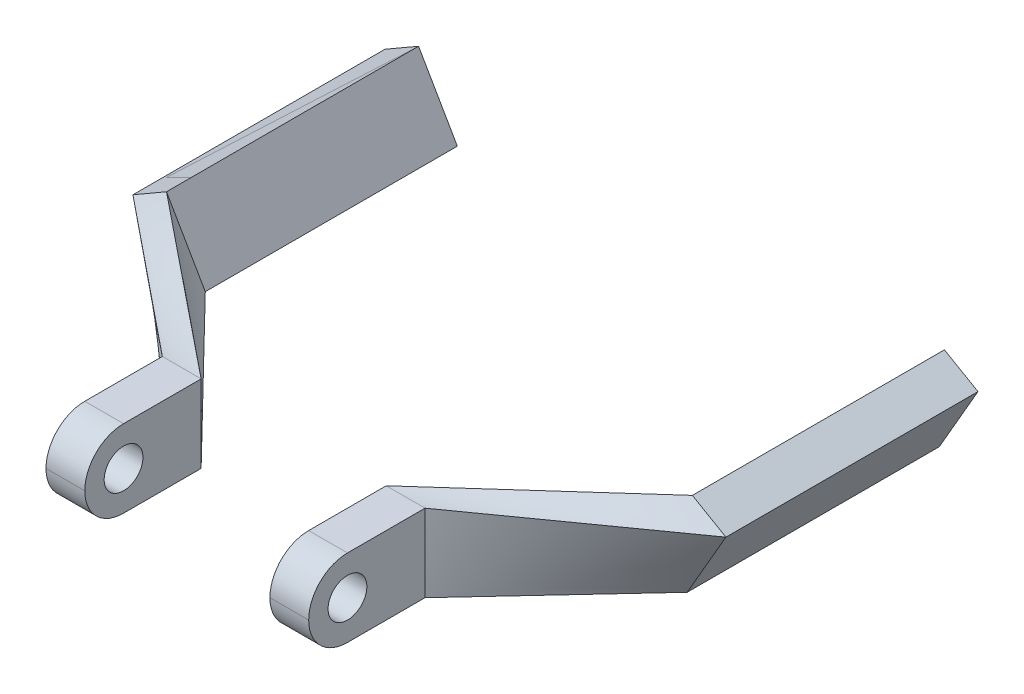
from build123d import *

# Parameters (mm, degrees)
BOSS_EXTRUDE1_DEPTH        = 50
BOSS_EXTRUDE1_DEPTH_BACK   = 15
BOSS_EXTRUDE1_2_DEPTH      = 50
BOSS_EXTRUDE1_2_DEPTH_BACK = 15
BOSS_EXTRUDE2_START        = 35
SKETCH2_W                  = 10
SKETCH2_H                  = 20
BOSS_EXTRUDE2_DEPTH        = 30
SKETCH3_R                  = 5
CUT_EXTRUDE1_DEPTH         = 173.149999612
FILLET3_R                  = 10
FILLET4_R                  = 10


with BuildPart() as part:
    # Sketch1 → Boss-Extrude1 (new, two sides: drawn at the far end of the back side and taken through both)
    with BuildSketch(Plane.XY.offset(-BOSS_EXTRUDE1_DEPTH_BACK)):
        Polygon((-66.457259422, -65.10734985), (-57.797005384, -60.10734985), (-67.797005384, -42.786841774), (-76.457259422, -47.786841774), align=None)
    extrude(amount=BOSS_EXTRUDE1_DEPTH + BOSS_EXTRUDE1_DEPTH_BACK)


with BuildPart() as body_2:
    # Sketch1 → Boss-Extrude1 2 (new, two sides: drawn at the far end of the back side and taken through both)
    with BuildSketch(Plane.XY.offset(-BOSS_EXTRUDE1_2_DEPTH_BACK)):
        Polygon((57.797005384, -60.10734985), (66.457259422, -65.10734985), (76.457259422, -47.786841774), (67.797005384, -42.786841774), align=None)
    extrude(amount=BOSS_EXTRUDE1_2_DEPTH + BOSS_EXTRUDE1_2_DEPTH_BACK)



with BuildPart() as body_3:
    # Sketch2 → Boss-Extrude2 (new body)
    with BuildSketch(Plane.XY.offset(50).offset(BOSS_EXTRUDE2_START)):
        with Locations((28.867965831, -55.10734985)):
            Rectangle(SKETCH2_W, SKETCH2_H)
    extrude(amount=BOSS_EXTRUDE2_DEPTH)


with BuildPart() as body_2_1:
    add(body_2.part)

    add(body_3.part)  # loft2 joins it to this body
    # loft from a face of the part (loft2)
    loft([body_2_1.faces().sort_by_distance((67.127132403, -53.947095812, 50))[0], body_2_1.faces().sort_by_distance((28.867965831, -55.10734985, 85))[0]])


with BuildPart() as body_3_2:
    # Mirror3: mirrored copy
    add(body_2_1.part.mirror(Plane.ZY))


with BuildPart() as cut_extrude1_tool:
    # Sketch3 → Cut-Extrude1 (new, through all)
    with BuildSketch(Plane.ZY.offset(33.867965831)):
        with Locations(Location((105, -55.10734985, 0), (0, 0, 270))):
            Circle(SKETCH3_R)
    extrude(amount=-CUT_EXTRUDE1_DEPTH)


with BuildPart() as body_2_2:
    add(body_2_1.part)

    # Cut-Extrude1: cut by cut_extrude1_tool
    add(cut_extrude1_tool.part, mode=Mode.SUBTRACT)

    # Fillet4
    fillet4_edges = [body_2_2.edges().sort_by_distance(p)[0] for p in [
        (28.867965831, -45.10734985, 115),
        (28.867965831, -65.10734985, 115),
    ]]
    fillet(fillet4_edges, radius=FILLET4_R - 0.0001)  # a hair under: the kernel refuses the full size


with BuildPart() as body_3_2_1:
    add(body_3_2.part)

    # Cut-Extrude1: cut by cut_extrude1_tool
    add(cut_extrude1_tool.part, mode=Mode.SUBTRACT)

    # Fillet3
    fillet3_edges = [body_3_2_1.edges().sort_by_distance(p)[0] for p in [
        (-28.867965831, -65.10734985, 115),
        (-28.867965831, -45.10734985, 115),
    ]]
    fillet(fillet3_edges, radius=FILLET3_R - 0.0001)  # a hair under: the kernel refuses the full size


solid = Compound([part.part, body_2_2.part, body_3_2_1.part])
